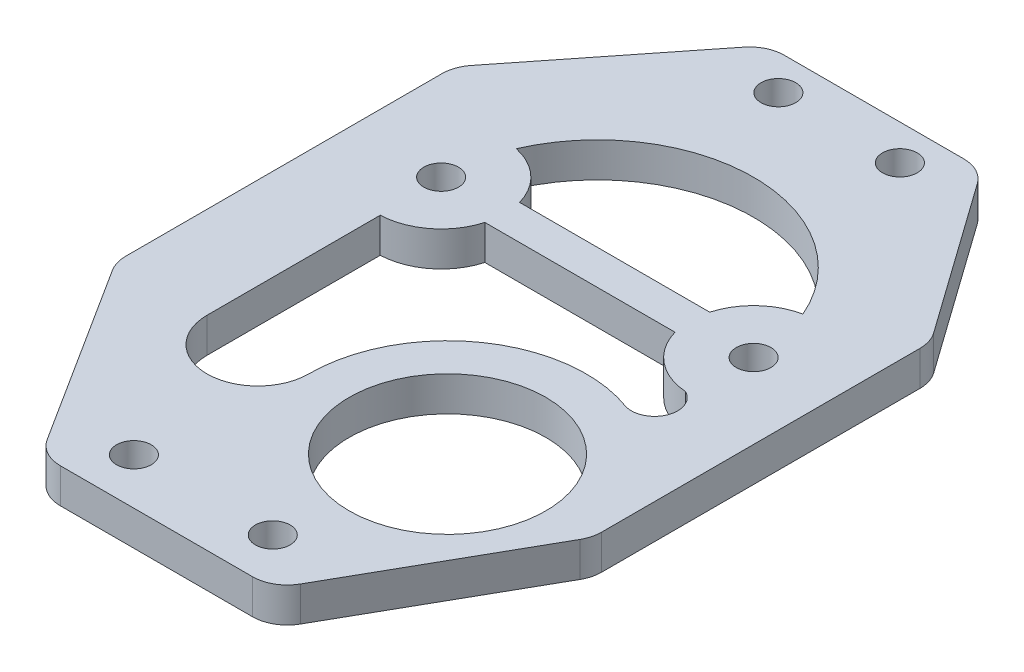
from build123d import *

# Parameters (mm, degrees)
SKETCH1_R          = 8.5
SKETCH1_R_2        = 1.5
BASE_FLANGE1_DEPTH = 3


# Sheet-metal steps are written as plain solids
with BuildPart() as part:
    # Sketch1 → Base-Flange1 (new body)
    with BuildSketch(Plane(origin=(0, 0, 0), x_dir=(1, 0, 0), z_dir=(0, 1, 0))):
        with BuildLine():
            Line((19.609421573, -14.059417906), (10.862109445, -29.480175346))
            ThreePointArc((10.862109445, -29.480175346), (9.762567662, -30.59234701), (8.252687872, -31))
            Line((8.252687872, -31), (-8.352599575, -31))
            ThreePointArc((-8.352599575, -31), (-9.796606082, -30.629609326), (-10.884048227, -29.609896806))
            Line((-10.884048227, -29.609896806), (-20.742852548, -14.107625594))
            ThreePointArc((-20.742852548, -14.107625594), (-21.091885276, -13.336076582), (-21.211403896, -12.497728788))
            Line((-21.211403896, -12.497728788), (-21.211403896, 14.839305313))
            ThreePointArc((-21.211403896, 14.839305313), (-21.044943633, 15.824725306), (-20.564035521, 16.700789784))
            Line((-20.564035521, 16.700789784), (-10.150833328, 29.861484472))
            ThreePointArc((-10.150833328, 29.861484472), (-9.105019706, 30.700412322), (-7.798201703, 31))
            Line((-7.798201703, 31), (7.702138241, 31))
            ThreePointArc((7.702138241, 31), (9.077698333, 30.666052219), (10.147014932, 29.738556288))
            Line((10.147014932, 29.738556288), (19.444876691, 16.663267527))
            ThreePointArc((19.444876691, 16.663267527), (19.857851472, 15.837226972), (20, 14.924711239))
            Line((20, 14.924711239), (20, -12.57924256))
            ThreePointArc((20, -12.57924256), (19.900712388, -13.344662472), (19.609421573, -14.059417906))
        make_face()
        with Locations(Location((7.5, -13.4, 0), (0, 0, 270))):
            Circle(SKETCH1_R, mode=Mode.SUBTRACT)
        with Locations(Location((6, -27, 0), (0, 0, 270))):
            Circle(SKETCH1_R_2, mode=Mode.SUBTRACT)
        with Locations(Location((-6, -27, 0), (0, 0, 270))):
            Circle(SKETCH1_R_2, mode=Mode.SUBTRACT)
        with Locations(Location((5.25, 27.940782939, 0), (0, 0, 270))):
            Circle(SKETCH1_R_2, mode=Mode.SUBTRACT)
        with Locations(Location((-5.25, 27.940782939, 0), (0, 0, 270))):
            Circle(SKETCH1_R_2, mode=Mode.SUBTRACT)
        with Locations(Location((13.5, 7.05, 0), (0, 0, 270))):
            Circle(SKETCH1_R_2, mode=Mode.SUBTRACT)
        with Locations(Location((-13.5, 7.05, 0), (0, 0, 270))):
            Circle(SKETCH1_R_2, mode=Mode.SUBTRACT)
        with BuildLine():
            Line((-13.281403896, 0), (-13.281403896, 1.567980996))
            ThreePointArc((-13.281403896, 1.567980996), (-10.106558233, 2.738982767), (-8.222660082, 5.55))
            Line((-8.222660082, 5.55), (8.208497378, 5.55))
            ThreePointArc((8.208497378, 5.55), (10.031018679, 2.781959631), (13.113110627, 1.563624456))
            ThreePointArc((13.113110627, 1.563624456), (14.07117407, -0.953003234), (11.655254401, -2.142386538))
            ThreePointArc((11.655254401, -2.142386538), (0.639353267, -3.554619032), (-4.5, -13.4))
            ThreePointArc((-4.5, -13.4), (-8.890701948, -17.790701948), (-13.281403896, -13.4))
            Line((-13.281403896, -13.4), (-13.281403896, 0))
        make_face(mode=Mode.SUBTRACT)
        with BuildLine():
            Line((-8.222660082, 8.55), (8.208497378, 8.55))
            ThreePointArc((8.208497378, 8.55), (9.751572067, 11.074833914), (12.37962963, 12.434679214))
            ThreePointArc((12.37962963, 12.434679214), (-0.006957749, 20.549998207), (-12.385173459, 12.42191571))
            ThreePointArc((-12.385173459, 12.42191571), (-9.763306163, 11.067142739), (-8.222660082, 8.55))
        make_face(mode=Mode.SUBTRACT)
    extrude(amount=BASE_FLANGE1_DEPTH)


solid = part.part
